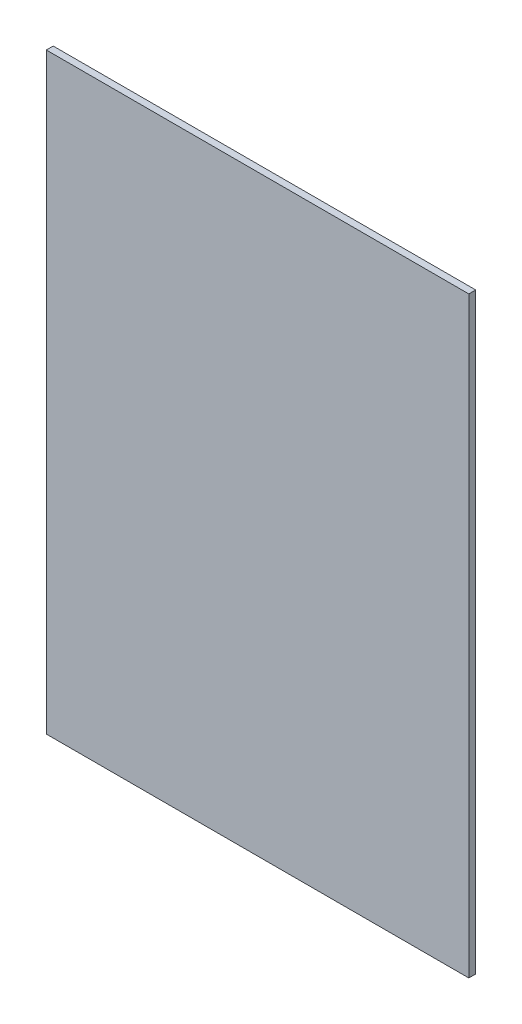
from build123d import *

# Parameters (mm, degrees)
SKETCH1_W           = 184
SKETCH1_H           = 258
BOSS_EXTRUDE1_DEPTH = 3


with BuildPart() as part:
    # Sketch1 → Boss-Extrude1 (new body)
    with BuildSketch(Plane.XY):
        with Locations((92, 129)):
            Rectangle(SKETCH1_W, SKETCH1_H)
    extrude(amount=BOSS_EXTRUDE1_DEPTH)


solid = part.part
